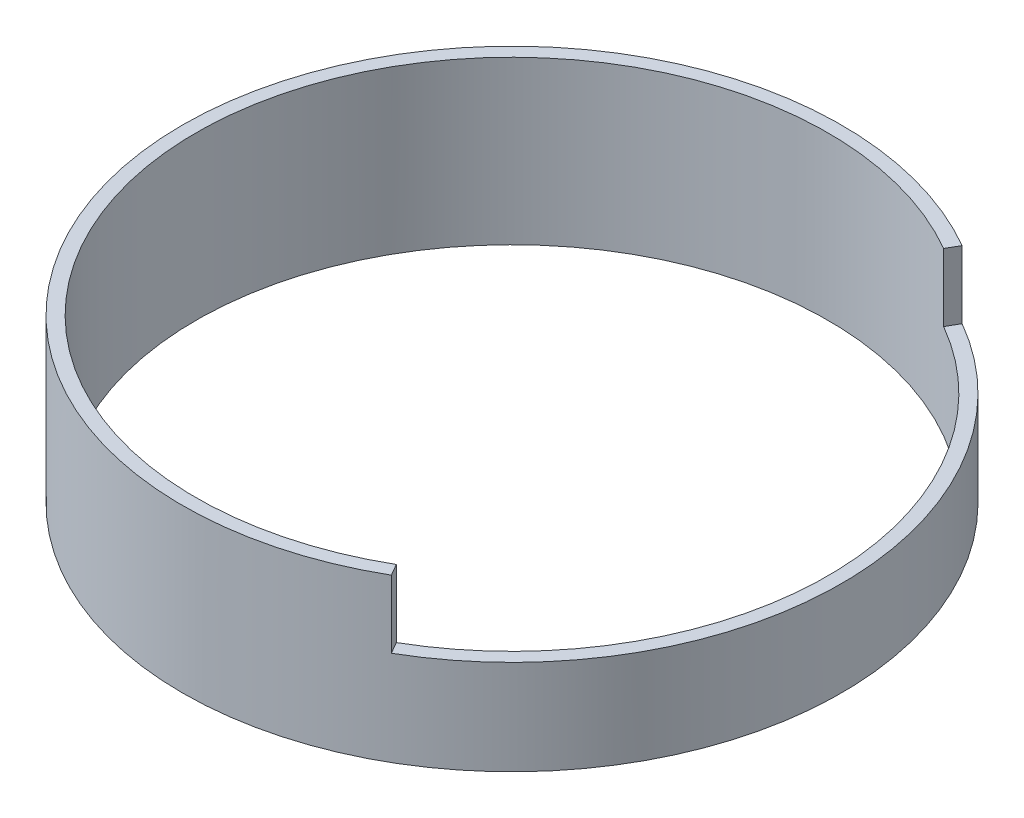
from build123d import *

# Parameters (mm, degrees)
BOSS_EXTRUDE1_DEPTH = 38.1
SKETCH1_3_R         = 77.31506
SKETCH1_3_R_2       = 74.14006
BOSS_EXTRUDE2_DEPTH = 22.225


with BuildPart() as part:
    # Sketch1 → Boss-Extrude1 (new body)
    with BuildSketch(Plane(origin=(0, 0, 0), x_dir=(1, 0, 0), z_dir=(0, 1, 0))):
        with BuildLine():
            Line((38.65753, -66.956806055), (37.07003, -64.207175398))
            ThreePointArc((37.07003, -64.207175398), (-74.14006, 0), (37.07003, 64.207175398))
            Line((37.07003, 64.207175398), (38.65753, 66.956806055))
            ThreePointArc((38.65753, 66.956806055), (-77.31506, 0), (38.65753, -66.956806055))
        make_face()
    extrude(amount=BOSS_EXTRUDE1_DEPTH)

    # Sketch1<3> → Boss-Extrude2 (add)
    with BuildSketch(Plane(origin=(0, 0, 0), x_dir=(1, 0, 0), z_dir=(0, 1, 0))):
        Circle(SKETCH1_3_R)
        Circle(SKETCH1_3_R_2, mode=Mode.SUBTRACT)
    extrude(amount=BOSS_EXTRUDE2_DEPTH)


solid = part.part
